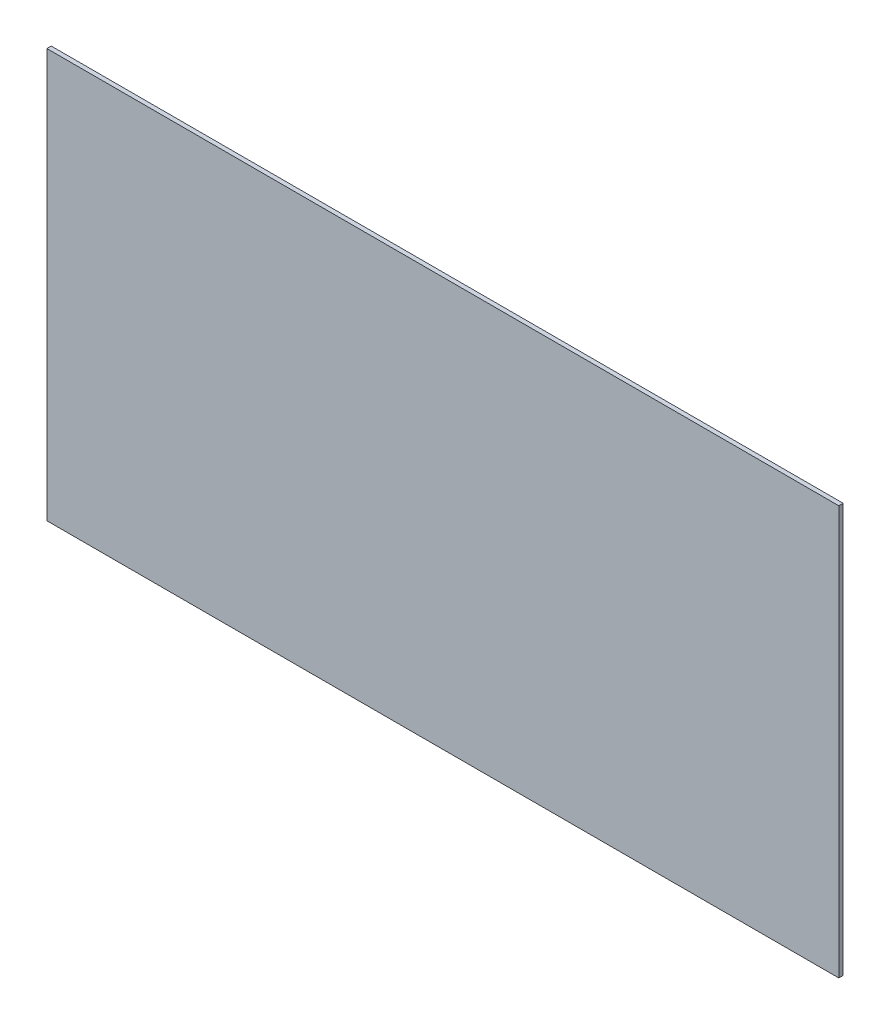
from build123d import *

# Parameters (mm, degrees)
SKETCH1_W           = 579
SKETCH1_H           = 299
BOSS_EXTRUDE1_DEPTH = 1.5875


with BuildPart() as part:
    # Sketch1 → Boss-Extrude1 (new, symmetric)
    with BuildSketch(Plane.XY):
        Rectangle(SKETCH1_W, SKETCH1_H)
    extrude(amount=BOSS_EXTRUDE1_DEPTH, both=True)


solid = part.part
